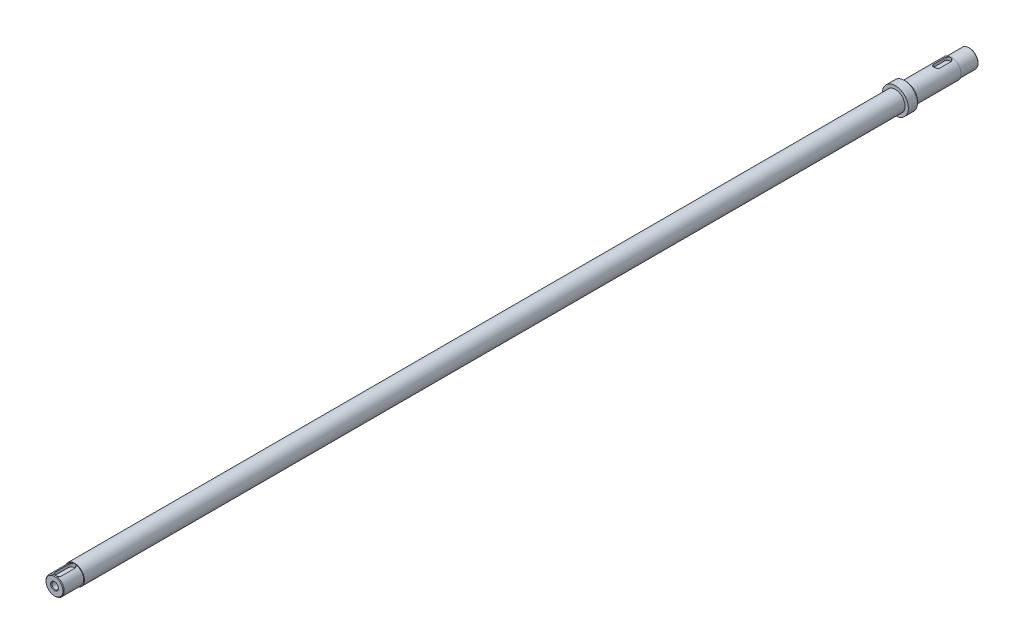
from build123d import *

# Parameters (mm, degrees)
SKETCH_1_R                = 7.5
EXTRUDE_1_DEPTH           = 715
SKETCH_4_R                = 7.5
SKETCH_4_R_2              = 7
CUT_EXTRUDE_3_DEPTH       = 14
CHAMFER_1_SIZE            = 0.5
CUT_EXTRUDE_START         = -27.5
SKETCH_6_R                = 7.5
SKETCH_6_R_2              = 7
CUT_EXTRUDE_5_DEPTH       = 27.5
CHAMFER_2_SIZE            = 1
CUT_EXTRUDE_START_2       = -12
SKETCH_7_R                = 7
SKETCH_7_R_2              = 6.9
CUT_EXTRUDE_6_DEPTH       = 12
SKETCH_8_R                = 10
SKETCH_8_R_2              = 7.5
EXTRUDE_2_DEPTH           = 8
CHAMFER_3_SIZE            = 1
CUT_EXTRUDE_8_DEPTH       = 2.5
CUT_EXTRUDE_11_DEPTH      = 2.5
CUT_EXTRUDE_11_DEPTH_BACK = 2
SKETCH_17_R               = 6.9
CUT_EXTRUDE_14_DEPTH      = 12
CHAMFER_6_SIZE            = 0.5
SKETCH_20_R               = 2.5
CUT_EXTRUDE_16_DEPTH      = 15
CHAMFER_7_SIZE            = 0.5


with BuildPart() as part:
    # 草图1 → 拉伸1 (new body)
    with BuildSketch(Plane.XY):
        Circle(SKETCH_1_R)
    extrude(amount=EXTRUDE_1_DEPTH)

    # 草图4 → 切除-拉伸3 (cut)
    with BuildSketch(Plane(origin=(0, 0, 0), x_dir=(-1, 0, 0), z_dir=(0, 0, -1))):
        Circle(SKETCH_4_R)
        Circle(SKETCH_4_R_2, mode=Mode.SUBTRACT)
    extrude(amount=-CUT_EXTRUDE_3_DEPTH, mode=Mode.SUBTRACT)

    # 倒角1
    chamfer_1_edges = [part.edges().sort_by_distance(p)[0] for p in [
        (7, 0, 0),
    ]]
    chamfer(chamfer_1_edges, length=CHAMFER_1_SIZE)

    # 草图6 → 切除-拉伸5 (cut)
    with BuildSketch(Plane.XY.offset(715).offset(CUT_EXTRUDE_START)):
        with Locations(Location((0, 0, 0), (0, 0, 180))):
            Circle(SKETCH_6_R)
        with Locations(Location((0, 0, 0), (0, 0, 180))):
            Circle(SKETCH_6_R_2, mode=Mode.SUBTRACT)
    extrude(amount=CUT_EXTRUDE_5_DEPTH, mode=Mode.SUBTRACT)

    # 倒角2
    chamfer_2_edges = [part.edges().sort_by_distance(p)[0] for p in [
        (7, 0, 715),
    ]]
    chamfer(chamfer_2_edges, length=CHAMFER_2_SIZE)

    # 草图7 → 切除-拉伸6 (cut)
    with BuildSketch(Plane.XY.offset(715).offset(CUT_EXTRUDE_START_2)):
        Circle(SKETCH_7_R)
        Circle(SKETCH_7_R_2, mode=Mode.SUBTRACT)
    extrude(amount=CUT_EXTRUDE_6_DEPTH, mode=Mode.SUBTRACT)

    # 草图8 → 拉伸2 (add)
    with BuildSketch(Plane(origin=(0, 0, 49), x_dir=(-1, 0, 0), z_dir=(0, 0, -1))):
        with Locations(Location((0, 0, 0), (0, 0, 90))):
            Circle(SKETCH_8_R)
        with Locations(Location((0, 0, 0), (0, 0, 90))):
            Circle(SKETCH_8_R_2, mode=Mode.SUBTRACT)
    extrude(amount=-EXTRUDE_2_DEPTH)

    # 倒角3
    chamfer_3_edges = [part.edges().sort_by_distance(p)[0] for p in [
        (0, -10, 49),
    ]]
    chamfer(chamfer_3_edges, length=CHAMFER_3_SIZE)

    # 草图11 → 切除-拉伸8 (cut)
    with BuildSketch(Plane(origin=(0, 7, 0), x_dir=(-1, 0, 0), z_dir=(0, 1, 0))):
        with BuildLine():
            Line((-2.5, 700), (-2.5, 690))
            ThreePointArc((-2.5, 690), (0, 687.5), (2.5, 690))
            Line((2.5, 690), (2.5, 700))
            ThreePointArc((2.5, 700), (0, 702.5), (-2.5, 700))
        make_face()
    extrude(amount=-CUT_EXTRUDE_8_DEPTH, mode=Mode.SUBTRACT)

    # 草图14 → 切除-拉伸11 (cut, two sides: drawn at the far end of the back side and taken through both)
    with BuildSketch(Plane(origin=(0, 7, 0), x_dir=(-1, 0, 0), z_dir=(0, 1, 0)).offset(-CUT_EXTRUDE_11_DEPTH_BACK)):
        with BuildLine():
            Line((-2.5, 25), (-2.5, 17))
            ThreePointArc((-2.5, 17), (0, 14.5), (2.5, 17))
            Line((2.5, 17), (2.5, 25))
            ThreePointArc((2.5, 25), (0, 27.5), (-2.5, 25))
        make_face()
    extrude(amount=CUT_EXTRUDE_11_DEPTH + CUT_EXTRUDE_11_DEPTH_BACK, mode=Mode.SUBTRACT)

    # 草图17 → 切除-拉伸14 (cut)
    with BuildSketch(Plane.XY.offset(715).offset(CUT_EXTRUDE_START_2)):
        Circle(SKETCH_17_R)
    extrude(amount=CUT_EXTRUDE_14_DEPTH, mode=Mode.SUBTRACT)

    # 倒角6
    chamfer_6_edges = [part.edges().sort_by_distance(p)[0] for p in [
        (7, 0, 703),
    ]]
    chamfer(chamfer_6_edges, length=CHAMFER_6_SIZE - 0.0001)  # a hair under: the kernel refuses the full size

    # 草图20 → 切除-拉伸16 (cut)
    with BuildSketch(Plane.XY.offset(703)):
        Circle(SKETCH_20_R)
    extrude(amount=-CUT_EXTRUDE_16_DEPTH, mode=Mode.SUBTRACT)

    # 倒角7
    chamfer_7_edges = [part.edges().sort_by_distance(p)[0] for p in [
        (-2.5, 0, 703),
    ]]
    chamfer(chamfer_7_edges, length=CHAMFER_7_SIZE)


solid = part.part
